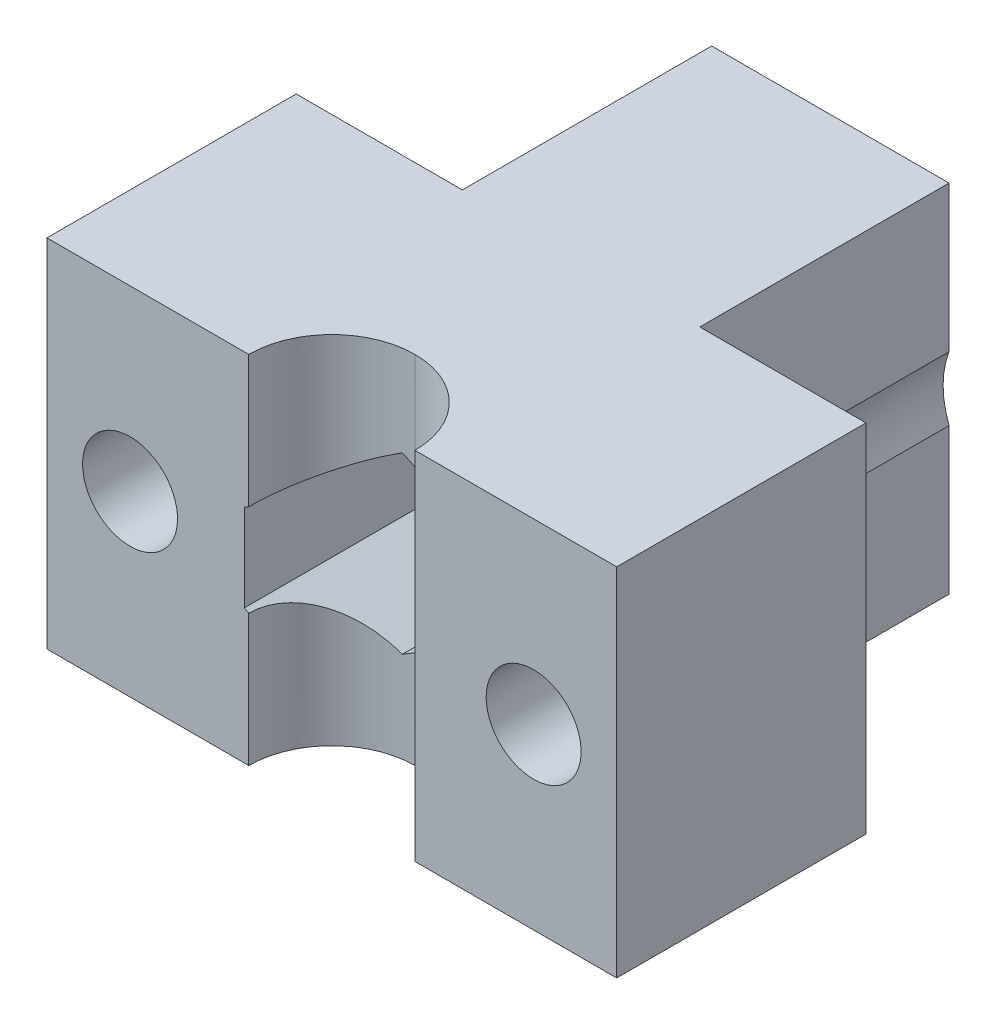
from build123d import *

# Parameters (mm, degrees)
SKETCH_1_W          = 48
SKETCH_1_H          = 20
EXTRUDE_1_DEPTH     = 30
SKETCH_2_W          = 14
SKETCH_2_H          = 30
CUT_EXTRUDE_1_DEPTH = 7
SKETCH_7_W          = 22
SKETCH_7_H          = 30
EXTRUDE_2_DEPTH     = 48
SKETCH_8_W          = 21
SKETCH_8_H          = 30
CUT_EXTRUDE_2_DEPTH = 14
SKETCH_9_W          = 21
SKETCH_9_H          = 30
CUT_EXTRUDE_3_DEPTH = 14
SKETCH_11_W         = 10.4
SKETCH_11_H         = 20.4
CUT_EXTRUDE_4_DEPTH = 56.497747702
SKETCH_13_R         = 4
CUT_EXTRUDE_5_DEPTH = 44.783558558
SKETCH_14_R         = 4
CUT_EXTRUDE_6_DEPTH = 44.783558558
FILLET_1_R          = 7
SKETCH1_W           = 10.4
SKETCH1_H           = 20.4
BOSS_EXTRUDE1_DEPTH = 4
SKETCH_20_R         = 7.5
CUT_EXTRUDE_8_DEPTH = 44.783558558
SKETCH3_R           = 4
CUT_EXTRUDE2_DEPTH  = 57.920997883
CUT_EXTRUDE3_START  = -25
CUT_EXTRUDE3_DEPTH  = 20


with BuildPart() as part:
    # Эскиз1 → Бобышка-Вытянуть1 (new body)
    with BuildSketch(Plane(origin=(0, 0, 0), x_dir=(1, 0, 0), z_dir=(0, 1, 0))):
        Rectangle(SKETCH_1_W, SKETCH_1_H)
    extrude(amount=EXTRUDE_1_DEPTH)

    # Эскиз2 → Вырез-Вытянуть1 (cut)
    with BuildSketch(Plane.XY.offset(10)):
        with Locations((0, 15)):
            Rectangle(SKETCH_2_W, SKETCH_2_H)
    extrude(amount=-CUT_EXTRUDE_1_DEPTH, mode=Mode.SUBTRACT)

    # Эскиз7 → Бобышка-Вытянуть2 (add)
    with BuildSketch(Plane(origin=(24, 0, 0), x_dir=(0, 0, -1), z_dir=(1, 0, 0))):
        with Locations((21, 15)):
            Rectangle(SKETCH_7_W, SKETCH_7_H)
    extrude(amount=-EXTRUDE_2_DEPTH)

    # Эскиз8 → Вырез-Вытянуть2 (cut)
    with BuildSketch(Plane(origin=(24, 0, 0), x_dir=(0, 0, -1), z_dir=(1, 0, 0))):
        with Locations((21.5, 15)):
            Rectangle(SKETCH_8_W, SKETCH_8_H)
    extrude(amount=-CUT_EXTRUDE_2_DEPTH, mode=Mode.SUBTRACT)

    # Эскиз9 → Вырез-Вытянуть3 (cut)
    with BuildSketch(Plane.ZY.offset(24)):
        with Locations((-21.5, 15)):
            Rectangle(SKETCH_9_W, SKETCH_9_H)
    extrude(amount=-CUT_EXTRUDE_3_DEPTH, mode=Mode.SUBTRACT)

    # Эскиз11 → Вырез-Вытянуть4 (cut, through all)
    with BuildSketch(Plane.ZY.offset(10)):
        with Locations((-21.5, 15)):
            Rectangle(SKETCH_11_W, SKETCH_11_H)
    extrude(amount=-CUT_EXTRUDE_4_DEPTH, mode=Mode.SUBTRACT)

    # Эскиз13 → Вырез-Вытянуть5 (cut, through all)
    with BuildSketch(Plane(origin=(0, 0, -11), x_dir=(-1, 0, 0), z_dir=(0, 0, -1))):
        with Locations((17, 15)):
            Circle(SKETCH_13_R)
    extrude(amount=-CUT_EXTRUDE_5_DEPTH, mode=Mode.SUBTRACT)

    # Эскиз14 → Вырез-Вытянуть6 (cut, through all)
    with BuildSketch(Plane(origin=(0, 0, -11), x_dir=(-1, 0, 0), z_dir=(0, 0, -1))):
        with Locations((-17, 15)):
            Circle(SKETCH_14_R)
    extrude(amount=-CUT_EXTRUDE_6_DEPTH, mode=Mode.SUBTRACT)

    # Скругление1
    fillet_1_edges = [part.edges().sort_by_distance(p)[0] for p in [
        (-7, 15, 3),
        (7, 15, 3),
    ]]
    fillet(fillet_1_edges, radius=FILLET_1_R - 0.0001)  # a hair under: the kernel refuses the full size

    # Sketch1 → Boss-Extrude1 (add)
    with BuildSketch(Plane(origin=(10, 0, 0), x_dir=(0, 0, -1), z_dir=(1, 0, 0))):
        with Locations((21.5, 15)):
            Rectangle(SKETCH1_W, SKETCH1_H)
    extrude(amount=-BOSS_EXTRUDE1_DEPTH)

    # Эскиз20 → Вырез-Вытянуть8 (cut, through all)
    with BuildSketch(Plane(origin=(0, 0, -11), x_dir=(-1, 0, 0), z_dir=(0, 0, -1))):
        with Locations((-17, 15)):
            Circle(SKETCH_20_R)
        with Locations((17, 15)):
            Circle(SKETCH_20_R)
    extrude(amount=CUT_EXTRUDE_8_DEPTH, mode=Mode.SUBTRACT)

    # Sketch3 → Cut-Extrude2 (cut, through all)
    with BuildSketch(Plane(origin=(0, 0, -32), x_dir=(-1, 0, 0), z_dir=(0, 0, -1))):
        with Locations(Location((1, 15, 0), (0, 0, 255.522487814))):
            Circle(SKETCH3_R)
    extrude(amount=-CUT_EXTRUDE2_DEPTH, mode=Mode.SUBTRACT)

    # Sketch4 → Cut-Extrude3 (cut)
    with BuildSketch(Plane(origin=(0, 0, -32), x_dir=(-1, 0, 0), z_dir=(0, 0, -1)).offset(CUT_EXTRUDE3_START)):
        Polygon((1, 22.35), (-5.365286718, 18.675), (-5.365286718, 11.325), (1, 7.65), (7.365286718, 11.325), (7.365286718, 18.675), align=None)
    extrude(amount=-CUT_EXTRUDE3_DEPTH, mode=Mode.SUBTRACT)


solid = part.part
